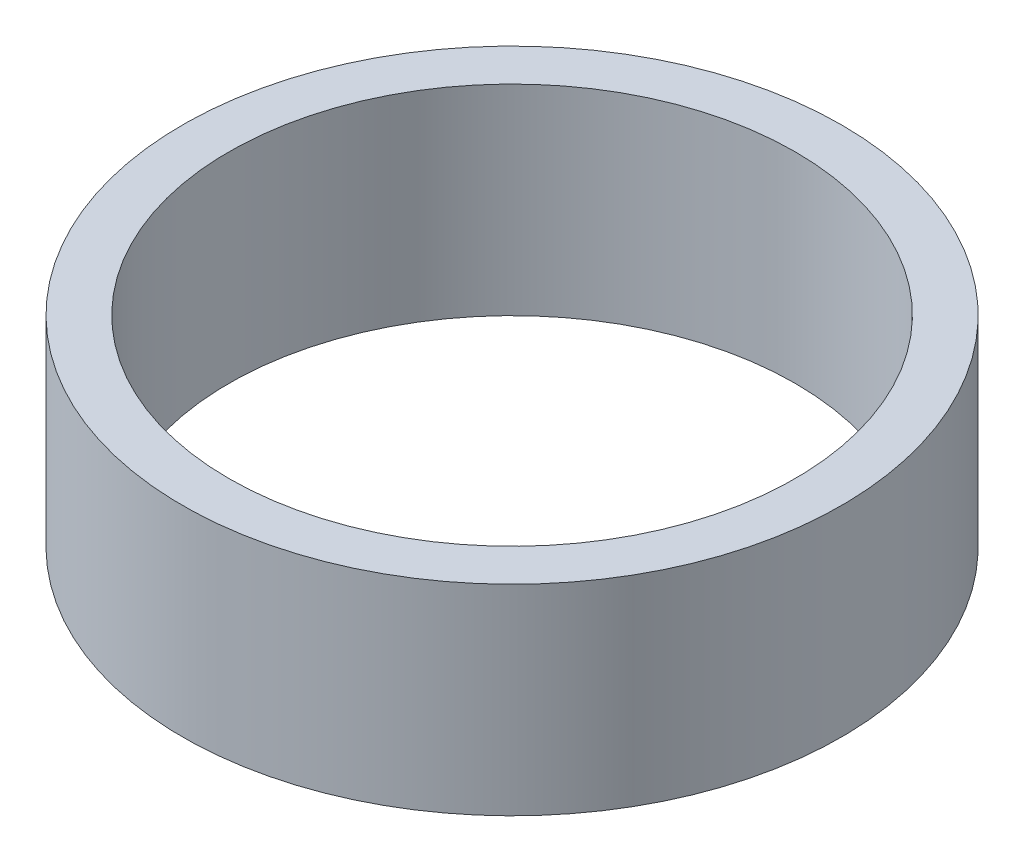
from build123d import *

# Parameters (mm, degrees)
SKETCH1_R           = 22.5
BOSS_EXTRUDE1_DEPTH = 13.692655993
SKETCH2_R           = 19.325962111
CUT_EXTRUDE1_DEPTH  = 35.640854899


with BuildPart() as part:
    # Sketch1 → Boss-Extrude1 (new body)
    with BuildSketch(Plane(origin=(0, 0, 0), x_dir=(1, 0, 0), z_dir=(0, 1, 0))):
        Circle(SKETCH1_R)
    extrude(amount=BOSS_EXTRUDE1_DEPTH)

    # Sketch2 → Cut-Extrude1 (cut, through all)
    with BuildSketch(Plane(origin=(0, 0, 0), x_dir=(1, 0, 0), z_dir=(0, 1, 0))):
        Circle(SKETCH2_R)
    extrude(amount=CUT_EXTRUDE1_DEPTH, mode=Mode.SUBTRACT)


solid = part.part
